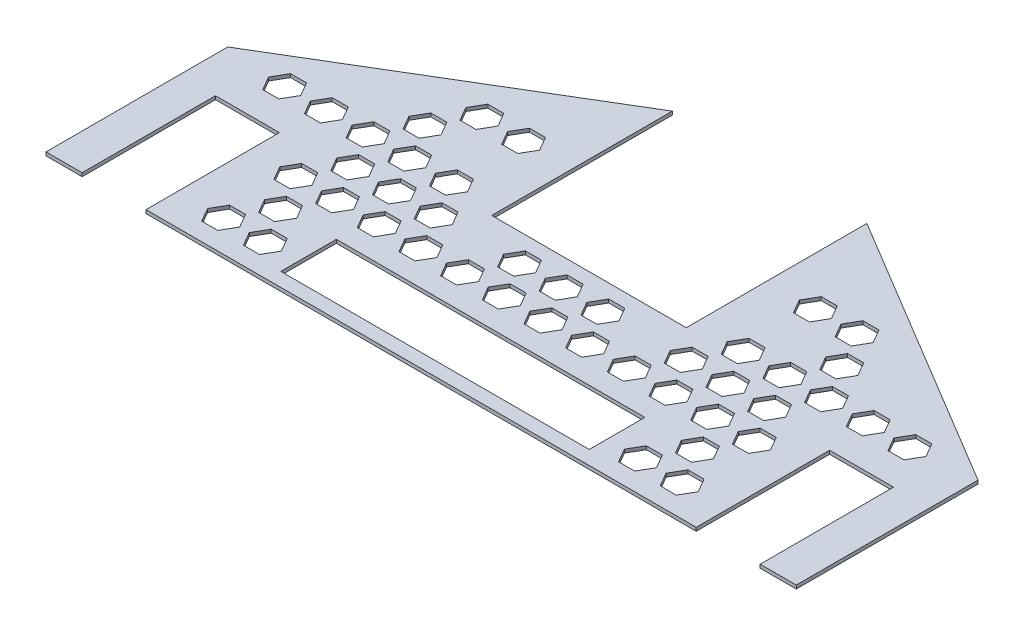
from build123d import *

# Parameters (mm, degrees)
SKETCH1_W           = 140.97
SKETCH1_H           = 25.4
BOSS_EXTRUDE1_DEPTH = 1.5875
CUT_EXTRUDE1_REACH  = 236.01
FILL_PATTERN3_DEPTH = 1.5875


# Read off the part's stored shape, not the designer's step: Fill Pattern3
with BuildPart() as part:
    # Sketch1 → Boss-Extrude1 (new body)
    with BuildSketch(Plane(origin=(0, 0, 0), x_dir=(1, 0, 0), z_dir=(0, 1, 0))):
        Polygon((-125.73, 0), (-125.73, 60.96), (-154.94, 60.96), (-154.94, 0), (-171.45, 0), (-171.45, 83.058), (-44.45, 159.258), (-44.45, 76.708), (44.45, 76.708), (44.45, 159.258), (171.45, 83.058), (171.45, 0), (154.94, 0), (154.94, 60.96), (125.73, 60.96), (125.73, 0), align=None)
        with Locations((0, 19.05)):
            Rectangle(SKETCH1_W, SKETCH1_H, mode=Mode.SUBTRACT)
    extrude(amount=BOSS_EXTRUDE1_DEPTH)

    # Sketch2 → Cut-Extrude1 (cut, up to next)
    with BuildSketch(Plane(origin=(0, 1.5875, 0), x_dir=(1, 0, 0), z_dir=(0, 1, 0)), mode=Mode.PRIVATE) as cut_extrude1_sk1:
        Polygon((7.332348419, 64.008), (3.666174209, 70.358), (-3.666174209, 70.358), (-7.332348419, 64.008), (-3.666174209, 57.658), (3.666174209, 57.658), align=None)
    cut_extrude1_tool1 = extrude(cut_extrude1_sk1.sketch, amount=-CUT_EXTRUDE1_REACH, mode=Mode.PRIVATE) & part.part
    add(cut_extrude1_tool1.solids().sort_by_distance((0, 1.5875, -64.008))[0], mode=Mode.SUBTRACT)

    # Fill Pattern3 outline → Fill Pattern3 (cut)
    with BuildSketch(Plane(origin=(0, 0, 0), x_dir=(1, 0, 0), z_dir=(0, 1, 0))):
        Polygon((-13.191174209, 41.160216058), (-5.858825791, 41.160216058), (-2.192651581, 47.510216058), (-5.858825791, 53.860216058), (-13.191174209, 53.860216058), (-16.857348419, 47.510216058), align=None)
        Polygon((11.717651581, 64.008), (15.383825791, 57.658), (22.716174209, 57.658), (26.382348419, 64.008), (22.716174209, 70.358), (15.383825791, 70.358), align=None)
        Polygon((-26.382348419, 64.008), (-22.716174209, 57.658), (-15.383825791, 57.658), (-11.717651581, 64.008), (-15.383825791, 70.358), (-22.716174209, 70.358), align=None)
        Polygon((-83.532348419, 64.008), (-79.866174209, 57.658), (-72.533825791, 57.658), (-68.867651581, 64.008), (-72.533825791, 70.358), (-79.866174209, 70.358), align=None)
        Polygon((-64.482348419, 64.008), (-60.816174209, 57.658), (-53.483825791, 57.658), (-49.817651581, 64.008), (-53.483825791, 70.358), (-60.816174209, 70.358), align=None)
        Polygon((87.917651581, 64.008), (91.583825791, 57.658), (98.916174209, 57.658), (102.582348419, 64.008), (98.916174209, 70.358), (91.583825791, 70.358), align=None)
        Polygon((49.817651581, 64.008), (53.483825791, 57.658), (60.816174209, 57.658), (64.482348419, 64.008), (60.816174209, 70.358), (53.483825791, 70.358), align=None)
        Polygon((68.867651581, 64.008), (72.533825791, 57.658), (79.866174209, 57.658), (83.532348419, 64.008), (79.866174209, 70.358), (72.533825791, 70.358), align=None)
        Polygon((-102.582348419, 64.008), (-98.916174209, 57.658), (-91.583825791, 57.658), (-87.917651581, 64.008), (-91.583825791, 70.358), (-98.916174209, 70.358), align=None)
        Polygon((5.858825791, 53.860216058), (2.192651581, 47.510216058), (5.858825791, 41.160216058), (13.191174209, 41.160216058), (16.857348419, 47.510216058), (13.191174209, 53.860216058), align=None)
        Polygon((21.242651581, 47.510216058), (24.908825791, 41.160216058), (32.241174209, 41.160216058), (35.907348419, 47.510216058), (32.241174209, 53.860216058), (24.908825791, 53.860216058), align=None)
        Polygon((-54.957348419, 47.510216058), (-51.291174209, 41.160216058), (-43.958825791, 41.160216058), (-40.292651581, 47.510216058), (-43.958825791, 53.860216058), (-51.291174209, 53.860216058), align=None)
        Polygon((-35.907348419, 47.510216058), (-32.241174209, 41.160216058), (-24.908825791, 41.160216058), (-21.242651581, 47.510216058), (-24.908825791, 53.860216058), (-32.241174209, 53.860216058), align=None)
        Polygon((-93.057348419, 47.510216058), (-89.391174209, 41.160216058), (-82.058825791, 41.160216058), (-78.392651581, 47.510216058), (-82.058825791, 53.860216058), (-89.391174209, 53.860216058), align=None)
        Polygon((-74.007348419, 47.510216058), (-70.341174209, 41.160216058), (-63.008825791, 41.160216058), (-59.342651581, 47.510216058), (-63.008825791, 53.860216058), (-70.341174209, 53.860216058), align=None)
        Polygon((78.392651581, 47.510216058), (82.058825791, 41.160216058), (89.391174209, 41.160216058), (93.057348419, 47.510216058), (89.391174209, 53.860216058), (82.058825791, 53.860216058), align=None)
        Polygon((97.442651581, 47.510216058), (101.108825791, 41.160216058), (108.441174209, 41.160216058), (112.107348419, 47.510216058), (108.441174209, 53.860216058), (101.108825791, 53.860216058), align=None)
        Polygon((40.292651581, 47.510216058), (43.958825791, 41.160216058), (51.291174209, 41.160216058), (54.957348419, 47.510216058), (51.291174209, 53.860216058), (43.958825791, 53.860216058), align=None)
        Polygon((59.342651581, 47.510216058), (63.008825791, 41.160216058), (70.341174209, 41.160216058), (74.007348419, 47.510216058), (70.341174209, 53.860216058), (63.008825791, 53.860216058), align=None)
        Polygon((-112.107348419, 47.510216058), (-108.441174209, 41.160216058), (-101.108825791, 41.160216058), (-97.442651581, 47.510216058), (-101.108825791, 53.860216058), (-108.441174209, 53.860216058), align=None)
        Polygon((63.008825791, 107.151351826), (70.341174209, 107.151351826), (74.007348419, 113.501351826), (70.341174209, 119.851351826), (63.008825791, 119.851351826), (59.342651581, 113.501351826), align=None)
        Polygon((78.392651581, 113.501351826), (82.058825791, 107.151351826), (89.391174209, 107.151351826), (93.057348419, 113.501351826), (89.391174209, 119.851351826), (82.058825791, 119.851351826), align=None)
        Polygon((-93.057348419, 113.501351826), (-89.391174209, 107.151351826), (-82.058825791, 107.151351826), (-78.392651581, 113.501351826), (-82.058825791, 119.851351826), (-89.391174209, 119.851351826), align=None)
        Polygon((-74.007348419, 113.501351826), (-70.341174209, 107.151351826), (-63.008825791, 107.151351826), (-59.342651581, 113.501351826), (-63.008825791, 119.851351826), (-70.341174209, 119.851351826), align=None)
        Polygon((82.058825791, 86.855783942), (78.392651581, 80.505783942), (82.058825791, 74.155783942), (89.391174209, 74.155783942), (93.057348419, 80.505783942), (89.391174209, 86.855783942), align=None)
        Polygon((-70.341174209, 86.855783942), (-74.007348419, 80.505783942), (-70.341174209, 74.155783942), (-63.008825791, 74.155783942), (-59.342651581, 80.505783942), (-63.008825791, 86.855783942), align=None)
        Polygon((-108.441174209, 8.164648174), (-101.108825791, 8.164648174), (-97.442651581, 14.514648174), (-101.108825791, 20.864648174), (-108.441174209, 20.864648174), (-112.107348419, 14.514648174), align=None)
        Polygon((-98.916174209, 24.662432116), (-91.583825791, 24.662432116), (-87.917651581, 31.012432116), (-91.583825791, 37.362432116), (-98.916174209, 37.362432116), (-102.582348419, 31.012432116), align=None)
        Polygon((-93.057348419, 14.514648174), (-89.391174209, 8.164648174), (-82.058825791, 8.164648174), (-78.392651581, 14.514648174), (-82.058825791, 20.864648174), (-89.391174209, 20.864648174), align=None)
        Polygon((78.392651581, 14.514648174), (82.058825791, 8.164648174), (89.391174209, 8.164648174), (93.057348419, 14.514648174), (89.391174209, 20.864648174), (82.058825791, 20.864648174), align=None)
        Polygon((97.442651581, 14.514648174), (101.108825791, 8.164648174), (108.441174209, 8.164648174), (112.107348419, 14.514648174), (108.441174209, 20.864648174), (101.108825791, 20.864648174), align=None)
        Polygon((-146.541174209, 86.855783942), (-150.207348419, 80.505783942), (-146.541174209, 74.155783942), (-139.208825791, 74.155783942), (-135.542651581, 80.505783942), (-139.208825791, 86.855783942), align=None)
        Polygon((87.917651581, 31.012432116), (91.583825791, 24.662432116), (98.916174209, 24.662432116), (102.582348419, 31.012432116), (98.916174209, 37.362432116), (91.583825791, 37.362432116), align=None)
        Polygon((-127.491174209, 86.855783942), (-131.157348419, 80.505783942), (-127.491174209, 74.155783942), (-120.158825791, 74.155783942), (-116.492651581, 80.505783942), (-120.158825791, 86.855783942), align=None)
        Polygon((-108.441174209, 86.855783942), (-112.107348419, 80.505783942), (-108.441174209, 74.155783942), (-101.108825791, 74.155783942), (-97.442651581, 80.505783942), (-101.108825791, 86.855783942), align=None)
        Polygon((-98.916174209, 103.353567884), (-102.582348419, 97.003567884), (-98.916174209, 90.653567884), (-91.583825791, 90.653567884), (-87.917651581, 97.003567884), (-91.583825791, 103.353567884), align=None)
        Polygon((-89.391174209, 86.855783942), (-93.057348419, 80.505783942), (-89.391174209, 74.155783942), (-82.058825791, 74.155783942), (-78.392651581, 80.505783942), (-82.058825791, 86.855783942), align=None)
        Polygon((97.442651581, 80.505783942), (101.108825791, 74.155783942), (108.441174209, 74.155783942), (112.107348419, 80.505783942), (108.441174209, 86.855783942), (101.108825791, 86.855783942), align=None)
        Polygon((116.492651581, 80.505783942), (120.158825791, 74.155783942), (127.491174209, 74.155783942), (131.157348419, 80.505783942), (127.491174209, 86.855783942), (120.158825791, 86.855783942), align=None)
        Polygon((59.342651581, 80.505783942), (63.008825791, 74.155783942), (70.341174209, 74.155783942), (74.007348419, 80.505783942), (70.341174209, 86.855783942), (63.008825791, 86.855783942), align=None)
        Polygon((135.542651581, 80.505783942), (139.208825791, 74.155783942), (146.541174209, 74.155783942), (150.207348419, 80.505783942), (146.541174209, 86.855783942), (139.208825791, 86.855783942), align=None)
        Polygon((91.583825791, 103.353567884), (87.917651581, 97.003567884), (91.583825791, 90.653567884), (98.916174209, 90.653567884), (102.582348419, 97.003567884), (98.916174209, 103.353567884), align=None)
    extrude(amount=FILL_PATTERN3_DEPTH, mode=Mode.SUBTRACT)


solid = part.part
